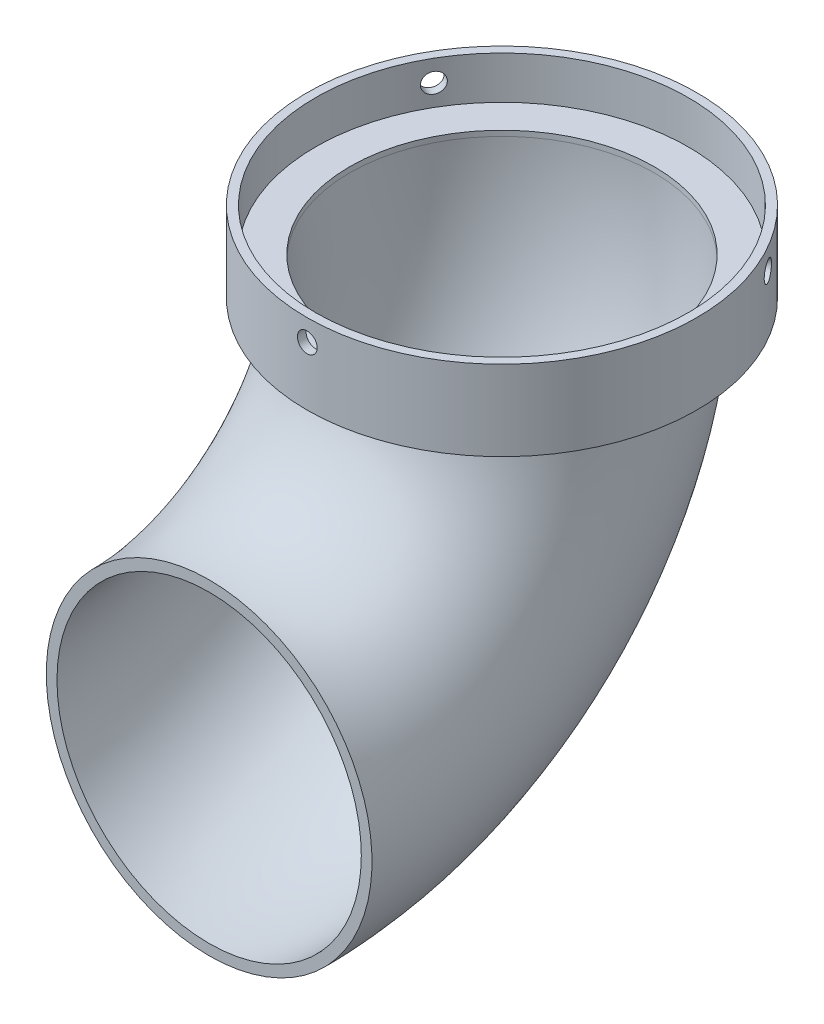
from build123d import *

# Parameters (mm, degrees)
SKETCH2_R           = 30.5
SKETCH2_R_2         = 28.5
BOSS_EXTRUDE2_DEPTH = 1
SKETCH7_R           = 36.5
SKETCH7_R_2         = 30.5
SKETCH7_R_3         = 34.9
BOSS_EXTRUDE3_DEPTH = 7
SKETCH7_3_R         = 36.5
SKETCH7_3_R_2       = 34.9
BOSS_EXTRUDE5_DEPTH = 8
SKETCH14_R          = 1.85
CUT_EXTRUDE1_DEPTH  = 8
CIRPATTERN1_COUNT   = 3
SWEEP1_OUTLINE_R    = 30.5
SWEEP1_OUTLINE_R_2  = 28.5
SWEEP1_ANGLE        = 90


# Read off the part's stored shape, not the designer's step: Sweep1
with BuildPart() as part:
    # Sketch2 → Boss-Extrude2 (new body)
    with BuildSketch(Plane(origin=(0, 50, 0), x_dir=(1, 0, 0), z_dir=(0, 1, 0))):
        with Locations(Location((0, 0, 0), (0, 0, 270))):
            Circle(SKETCH2_R)
        with Locations(Location((0, 0, 0), (0, 0, 270))):
            Circle(SKETCH2_R_2, mode=Mode.SUBTRACT)
    extrude(amount=BOSS_EXTRUDE2_DEPTH)



with BuildPart() as body_2:
    # Sketch7 → Boss-Extrude3 (new body)
    # profile 1 of 2: a face of its own
    with BuildSketch(Plane(origin=(0, 51, 0), x_dir=(1, 0, 0), z_dir=(0, 1, 0))):
        with Locations(Location((0, 0, 0), (0, 0, 270))):
            Circle(SKETCH7_R)
        with Locations(Location((0, 0, 0), (0, 0, 270))):
            Circle(SKETCH7_R_2, mode=Mode.SUBTRACT)
    # profile 2 of 2: a face of its own
    with BuildSketch(Plane(origin=(0, 51, 0), x_dir=(1, 0, 0), z_dir=(0, 1, 0))):
        with Locations(Location((0, 0, 0), (0, 0, 270))):
            Circle(SKETCH7_R)
        Circle(SKETCH7_R_3, mode=Mode.SUBTRACT)
    extrude(amount=-BOSS_EXTRUDE3_DEPTH)


with BuildPart() as part_1:
    add(part.part)

    add(body_2.part)  # Boss-Extrude5 merges body 2
    # Sketch7<3> → Boss-Extrude5 (add)
    with BuildSketch(Plane(origin=(0, 51, 0), x_dir=(1, 0, 0), z_dir=(0, 1, 0))):
        with Locations(Location((0, 0, 0), (0, 0, 270))):
            Circle(SKETCH7_3_R)
        with Locations(Location((0, 0, 0), (0, 0, 270))):
            Circle(SKETCH7_3_R_2, mode=Mode.SUBTRACT)
    extrude(amount=BOSS_EXTRUDE5_DEPTH)

    # Sketch14 → Cut-Extrude1 (cut)
    with BuildSketch(Plane.XY.offset(36.5)):
        with Locations(Location((0, 55, 0), (0, 0, 270))):
            Circle(SKETCH14_R)
    cut_extrude1 = extrude(amount=-CUT_EXTRUDE1_DEPTH, mode=Mode.SUBTRACT)

    # CirPattern1: Cut-Extrude1 ×3 about axis
    cirpattern1_axis = Axis((0, 0, 0), (0, 1, 0))
    for i in range(1, CIRPATTERN1_COUNT):
        add(cut_extrude1.rotate(cirpattern1_axis, i * 360 / CIRPATTERN1_COUNT), mode=Mode.SUBTRACT)

    # Sweep1 outline → Sweep1 (revolve)
    with BuildSketch(Plane(origin=(0, 50, 54.842660898), x_dir=(0, -1, 0), z_dir=(0, 0, 1))):
        with Locations((54.842660898, 0)):
            Circle(SWEEP1_OUTLINE_R)
        with Locations((54.842660898, 0)):
            Circle(SWEEP1_OUTLINE_R_2, mode=Mode.SUBTRACT)
    revolve(axis=Axis((0, 50, 54.842660898), (1, 0, 0)), revolution_arc=SWEEP1_ANGLE)


solid = part_1.part
